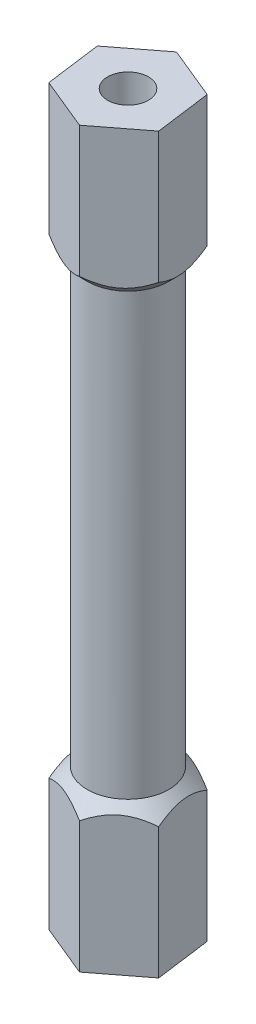
from build123d import *

# Parameters (mm, degrees)
SKETCH_1_R          = 2.5
EXTRUDE_1_DEPTH     = 45
EXTRUDE_2_DEPTH     = 8
EXTRUDE_3_DEPTH     = 8
CHAMFER_1_SIZE      = 1
SKETCH_4_R          = 1.25
CUT_EXTRUDE_1_DEPTH = 8
CUT_EXTRUDE_START   = 8
SKETCH_5_R          = 1.25
CUT_EXTRUDE_2_DEPTH = 8


with BuildPart() as part:
    # 草图1 → 凸台-拉伸1 (new body)
    with BuildSketch(Plane(origin=(0, 0, 0), x_dir=(1, 0, 0), z_dir=(0, 1, 0))):
        with Locations(Location((0, 0, 0), (0, 0, 90))):
            Circle(SKETCH_1_R)
    extrude(amount=EXTRUDE_1_DEPTH)

    # 草图2 → 凸台-拉伸2 (add)
    with BuildSketch(Plane(origin=(0, 45, 0), x_dir=(1, 0, 0), z_dir=(0, 1, 0))):
        Polygon((3.202903935, -1.319623577), (2.744279509, 2.113984385), (-0.458624426, 3.433607962), (-3.202903935, 1.319623577), (-2.744279509, -2.113984385), (0.458624426, -3.433607962), align=None)
    extrude(amount=-EXTRUDE_2_DEPTH)

    # 草图3 → 凸台-拉伸3 (add)
    with BuildSketch(Plane.XZ):
        Polygon((3.202903935, 1.319623577), (0.458624426, 3.433607962), (-2.744279509, 2.113984385), (-3.202903935, -1.319623577), (-0.458624426, -3.433607962), (2.744279509, -2.113984385), align=None)
    extrude(amount=-EXTRUDE_3_DEPTH)

    # 倒角1
    # the kernel refuses this chamfer: 1 mm, written as the material it adds along each edge
    with BuildSketch(Plane(origin=(0, 37, 0), x_dir=(0, 0, -1), z_dir=(-1, 0, 0))) as chamfer_1_piece_1_section:
        Polygon((2.5, CHAMFER_1_SIZE), (2.5 + CHAMFER_1_SIZE, 0), (2.5, 0), align=None)
    chamfer_1_piece_1 = revolve(axis=Axis((0, 37, 0), (0, -1, 0)), mode=Mode.PRIVATE)
    chamfer_1_piece_1 = split(chamfer_1_piece_1, bisect_by=Plane(origin=(3.361202761, 36.482096178, 2.504767848), z_dir=(-0.9911972405355005, 0, 0.13239346794615373)), keep=Keep.TOP, mode=Mode.PRIVATE)
    chamfer_1_piece_1 = split(chamfer_1_piece_1, bisect_by=Plane(origin=(0.402796537, 36.482096178, 3.476613525), z_dir=(-0.61025472680424, 0, -0.7922052564917015)), keep=Keep.TOP, mode=Mode.PRIVATE)
    chamfer_1_piece_1 = split(chamfer_1_piece_1, bisect_by=Plane(origin=(2.183184145, 36.482096178, -2.345160432), z_dir=(-0.3809425137312606, 0, 0.924598724437855)), keep=Keep.TOP, mode=Mode.PRIVATE)
    chamfer_1_piece_1 = split(chamfer_1_piece_1, bisect_by=Plane(origin=(-0.102470937, 36.482096178, 3.202431915), z_dir=(0.38094251373126053, 0, -0.924598724437855)), keep=Keep.TOP, mode=Mode.PRIVATE)
    chamfer_1_piece_1 = split(chamfer_1_piece_1, bisect_by=Plane(origin=(-3.258731824, 36.482096178, -1.276618014), z_dir=(0.6102547268042401, 0, 0.7922052564917015)), keep=Keep.TOP, mode=Mode.PRIVATE)
    chamfer_1_piece_1 = split(chamfer_1_piece_1, bisect_by=Plane(origin=(-2.585980682, 36.482096178, 3.299128656), z_dir=(0.9911972405355005, 0, -0.1323934679461537)), keep=Keep.TOP, mode=Mode.PRIVATE)
    add(chamfer_1_piece_1)
    with BuildSketch(Plane(origin=(0, 8, 0), x_dir=(0, 0, -1), z_dir=(-1, 0, 0))) as chamfer_1_piece_2_section:
        Polygon((2.5 + CHAMFER_1_SIZE, 0), (2.5, -CHAMFER_1_SIZE), (2.5, 0), align=None)
    chamfer_1_piece_2 = revolve(axis=Axis((0, 8, 0), (0, -1, 0)), mode=Mode.PRIVATE)
    chamfer_1_piece_2 = split(chamfer_1_piece_2, bisect_by=Plane(origin=(0.402796537, 8.517903822, 3.476613525), z_dir=(-0.61025472680424, 0, -0.7922052564917015)), keep=Keep.TOP, mode=Mode.PRIVATE)
    chamfer_1_piece_2 = split(chamfer_1_piece_2, bisect_by=Plane(origin=(3.361202761, 8.517903822, 2.504767848), z_dir=(-0.9911972405355005, 0, 0.13239346794615373)), keep=Keep.TOP, mode=Mode.PRIVATE)
    chamfer_1_piece_2 = split(chamfer_1_piece_2, bisect_by=Plane(origin=(-0.102470937, 8.517903822, 3.202431915), z_dir=(0.38094251373126053, 0, -0.924598724437855)), keep=Keep.TOP, mode=Mode.PRIVATE)
    chamfer_1_piece_2 = split(chamfer_1_piece_2, bisect_by=Plane(origin=(2.183184145, 8.517903822, -2.345160432), z_dir=(-0.3809425137312606, 0, 0.924598724437855)), keep=Keep.TOP, mode=Mode.PRIVATE)
    chamfer_1_piece_2 = split(chamfer_1_piece_2, bisect_by=Plane(origin=(-2.585980682, 8.517903822, 3.299128656), z_dir=(0.9911972405355005, 0, -0.1323934679461537)), keep=Keep.TOP, mode=Mode.PRIVATE)
    chamfer_1_piece_2 = split(chamfer_1_piece_2, bisect_by=Plane(origin=(-3.258731824, 8.517903822, -1.276618014), z_dir=(0.6102547268042401, 0, 0.7922052564917015)), keep=Keep.TOP, mode=Mode.PRIVATE)
    add(chamfer_1_piece_2)

    # 草图4 → 切除-拉伸1 (cut)
    with BuildSketch(Plane(origin=(0, 0, 0), x_dir=(-1, 0, 0), z_dir=(0, 1, 0))):
        with Locations(Location((0, 0, 0), (0, 0, 90))):
            Circle(SKETCH_4_R)
    extrude(amount=CUT_EXTRUDE_1_DEPTH, mode=Mode.SUBTRACT)

    # 草图5 → 切除-拉伸2 (cut)
    with BuildSketch(Plane(origin=(0, 45, 0), x_dir=(-1, 0, 0), z_dir=(0, -1, 0)).offset(CUT_EXTRUDE_START)):
        with Locations(Location((0, 0, 0), (0, 0, 270))):
            Circle(SKETCH_5_R)
    extrude(amount=-CUT_EXTRUDE_2_DEPTH, mode=Mode.SUBTRACT)


solid = part.part
